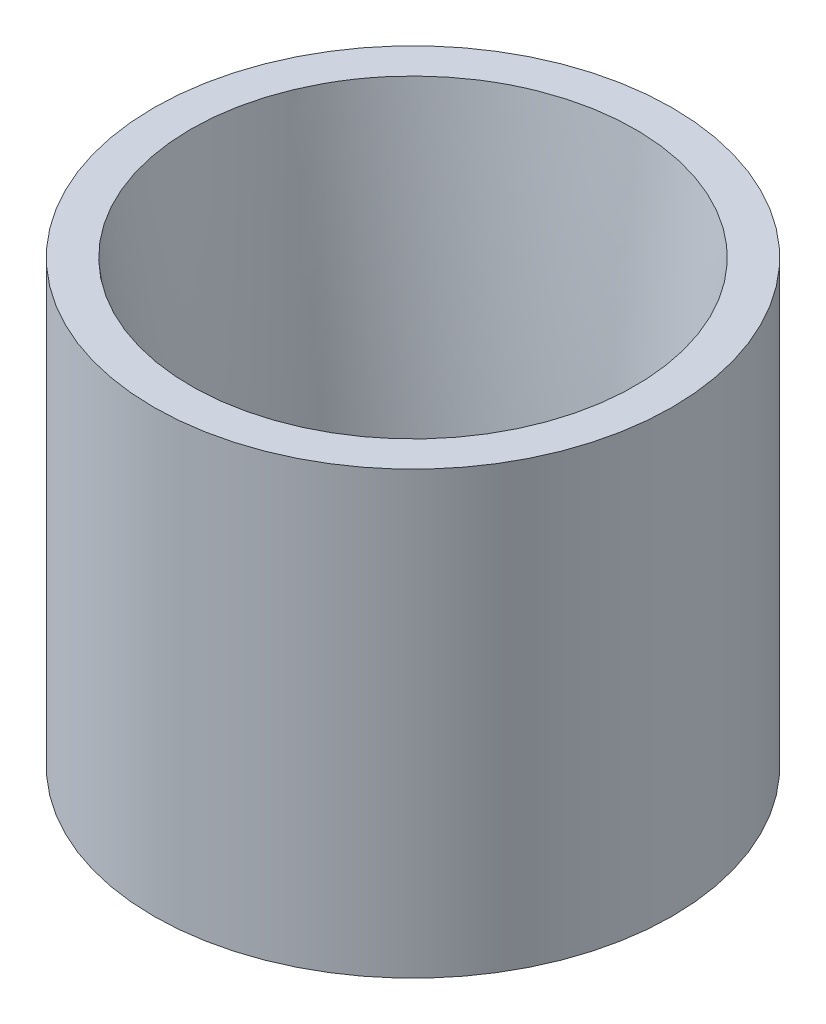
from build123d import *

# Parameters (mm, degrees)
SKETCH_1_R      = 35
EXTRUDE_1_DEPTH = 59.5


with BuildPart() as part:
    # 스케치1 → 보스-돌출1 (new body)
    with BuildSketch(Plane(origin=(0, 0, 0), x_dir=(1, 0, 0), z_dir=(0, 1, 0))):
        with Locations(Location((0, 0, 0), (0, 0, 270))):
            Circle(SKETCH_1_R)
    extrude(amount=EXTRUDE_1_DEPTH)

    # 컷-로프트1: read off the stored shape, not the designer's step
    # 컷-로프트1: loft between two sections, ruled curve by curve
    loft_1_from = [
        Edge.make_bspline([(19.895850284, 59.5, 22.45339933), (-25.010948375, 59.5, 62.245099898), (-64.802648944, 59.5, 17.338301239), (-19.895850284, 59.5, -22.45339933), (25.010948375, 59.5, -62.245099898), (64.802648944, 59.5, -17.338301239), (19.895850284, 59.5, 22.45339933)], [0, 0, 0, 0, 0.5, 0.5, 0.5, 1, 1, 1, 1], 3, [1, 0.333333333, 0.333333333, 1, 0.333333333, 0.333333333, 1]),
    ]
    loft_1_to = [
        Edge.make_bspline([(23.127373228, 5, 10.741257262), (1.644858704, 5, 56.996003718), (-44.609887752, 5, 35.513489194), (-23.127373228, 5, -10.741257262), (-1.644858704, 5, -56.996003718), (44.609887752, 5, -35.513489194), (23.127373228, 5, 10.741257262)], [0, 0, 0, 0, 0.5, 0.5, 0.5, 1, 1, 1, 1], 3, [1, 0.333333333, 0.333333333, 1, 0.333333333, 0.333333333, 1]),
    ]
    loft_1 = Solid(Shell([*[Face.make_surface_from_curves(loft_1_from[k], loft_1_to[k]) for k in range(1)], Face(Wire(loft_1_from)), Face(Wire(loft_1_to))]))
    add(loft_1, mode=Mode.SUBTRACT)


solid = part.part
